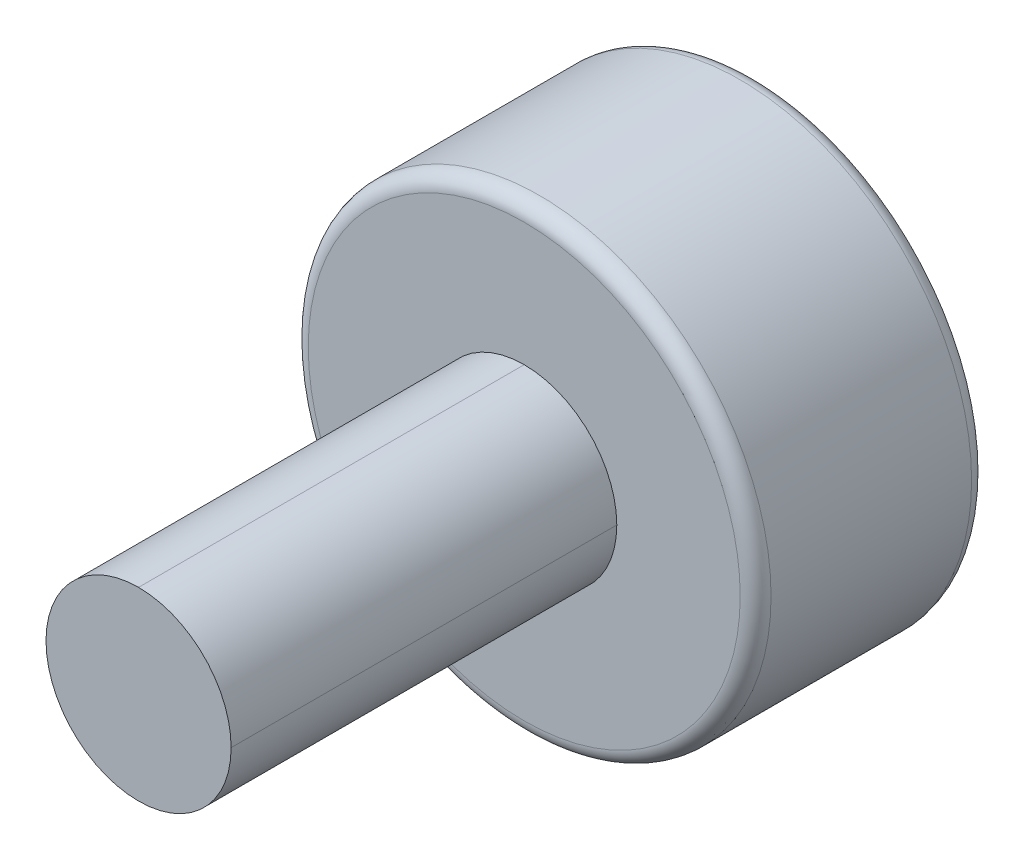
from build123d import *

# Parameters (mm, degrees)
ESQUISSE1_W        = 24
ESQUISSE1_H        = 24
BOSS_EXTRU_1_DEPTH = 50
ESQUISSE2_R        = 2.5
BOSS_EXTRU_3_DEPTH = 30
ESQUISSE3_R        = 30
BOSS_EXTRU_4_DEPTH = 30
CONG_1_R           = 2
CONG_2_R           = 2
CONG_3_R           = 12


with BuildPart() as part:
    # Esquisse1 → Boss.-Extru.1 (new body)
    with BuildSketch(Plane.XY):
        Rectangle(ESQUISSE1_W, ESQUISSE1_H)
    extrude(amount=BOSS_EXTRU_1_DEPTH)

    # Esquisse2 → Boss.-Extru.3 (add)
    with BuildSketch(Plane.XY):
        Circle(ESQUISSE2_R)
    extrude(amount=-BOSS_EXTRU_3_DEPTH)

    # Esquisse3 → Boss.-Extru.4 (add)
    with BuildSketch(Plane.XY):
        Circle(ESQUISSE3_R)
    extrude(amount=-BOSS_EXTRU_4_DEPTH)

    # Congé1
    cong_1_edges = [part.edges().sort_by_distance(p)[0] for p in [
        (-30, 0, -30),
    ]]
    fillet(cong_1_edges, radius=CONG_1_R)

    # Congé2
    cong_2_edges = [part.edges().sort_by_distance(p)[0] for p in [
        (-30, 0, 0),
    ]]
    fillet(cong_2_edges, radius=CONG_2_R)

    # Congé3
    cong_3_edges = [part.edges().sort_by_distance(p)[0] for p in [
        (-12, 12, 25),
        (12, 12, 25),
        (12, -12, 25),
        (-12, -12, 25),
    ]]
    fillet(cong_3_edges, radius=CONG_3_R - 0.0001)  # a hair under: the kernel refuses the full size


solid = part.part
